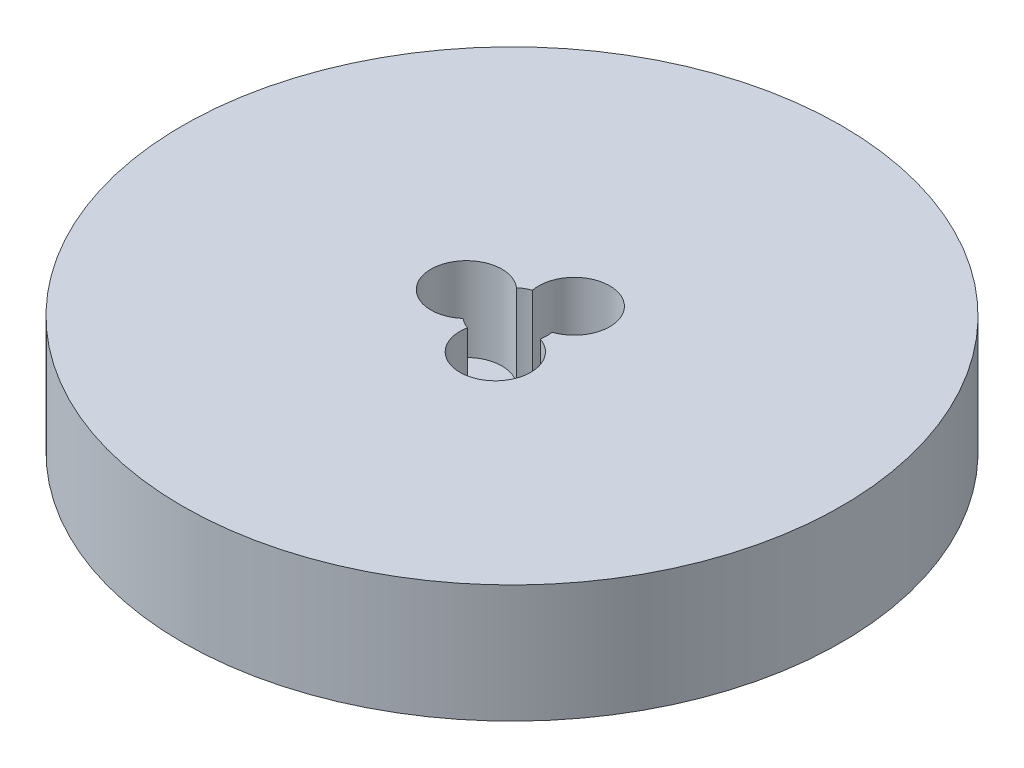
from build123d import *

# Parameters (mm, degrees)
SKETCH1_R           = 47.5
BOSS_EXTRUDE1_DEPTH = 17
SKETCH2_R           = 5
CUT_EXTRUDE1_DEPTH  = 70.292856775
SKETCH3_R           = 5.113955436
CUT_EXTRUDE2_DEPTH  = 12.092699356
CIRPATTERN1_COUNT   = 3


with BuildPart() as part:
    # Sketch1 → Boss-Extrude1 (new body)
    with BuildSketch(Plane(origin=(0, 0, 0), x_dir=(1, 0, 0), z_dir=(0, 1, 0))):
        Circle(SKETCH1_R)
    extrude(amount=BOSS_EXTRUDE1_DEPTH)

    # Sketch2 → Cut-Extrude1 (cut, through all)
    with BuildSketch(Plane(origin=(0, 0, 0), x_dir=(1, 0, 0), z_dir=(0, 1, 0))):
        Circle(SKETCH2_R)
    extrude(amount=CUT_EXTRUDE1_DEPTH, mode=Mode.SUBTRACT)

    # Sketch3 → Cut-Extrude2 (cut)
    with BuildSketch(Plane(origin=(0, 17, 0), x_dir=(1, 0, 0), z_dir=(0, 1, 0))):
        with Locations((-6.569276671, 0)):
            Circle(SKETCH3_R)
    cut_extrude2 = extrude(amount=-CUT_EXTRUDE2_DEPTH, mode=Mode.SUBTRACT)

    # CirPattern1: Cut-Extrude2 ×3 about axis
    cirpattern1_axis = Axis((0, 0, 0), (0, 1, 0))
    for i in range(1, CIRPATTERN1_COUNT):
        add(cut_extrude2.rotate(cirpattern1_axis, i * 360 / CIRPATTERN1_COUNT), mode=Mode.SUBTRACT)


solid = part.part
